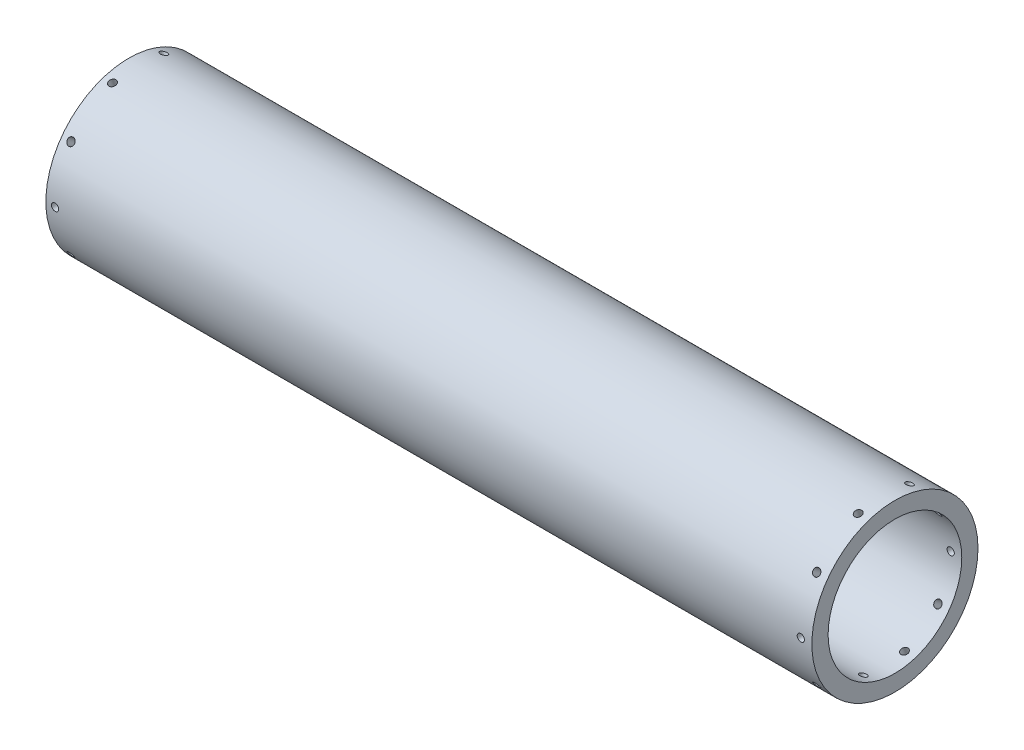
from build123d import *

# Parameters (mm, degrees)
SKETCH1_R           = 57.15
SKETCH1_R_2         = 45.974
BOSS_EXTRUDE1_DEPTH = 527.05
SKETCH2_R           = 57.15
SKETCH2_R_2         = 44.577
BOSS_EXTRUDE2_DEPTH = 88.9
SKETCH4_R           = 2.4892
CUT_EXTRUDE1_DEPTH  = 16.51
CIRPATTERN1_COUNT   = 10
SKETCH5_R           = 2.4892
CUT_EXTRUDE2_DEPTH  = 17.78
CIRPATTERN2_COUNT   = 10


with BuildPart() as part:
    # Sketch1 → Boss-Extrude1 (new body)
    with BuildSketch(Plane(origin=(0, 0, 0), x_dir=(0, 0, -1), z_dir=(1, 0, 0))):
        Circle(SKETCH1_R)
        Circle(SKETCH1_R_2, mode=Mode.SUBTRACT)
    extrude(amount=BOSS_EXTRUDE1_DEPTH)

    # Sketch2 → Boss-Extrude2 (add)
    with BuildSketch(Plane.ZY):
        Circle(SKETCH2_R)
        Circle(SKETCH2_R_2, mode=Mode.SUBTRACT)
    extrude(amount=-BOSS_EXTRUDE2_DEPTH)

    # Sketch4 → Cut-Extrude1 (cut)
    with BuildSketch(Plane.XY.offset(57.15)):
        with Locations((519.43, 0)):
            Circle(SKETCH4_R)
    cut_extrude1 = extrude(amount=-CUT_EXTRUDE1_DEPTH, mode=Mode.SUBTRACT)

    # CirPattern1: Cut-Extrude1 ×10 about axis
    cirpattern1_axis = Axis((0, 0, 0), (1, 0, 0))
    for i in range(1, CIRPATTERN1_COUNT):
        add(cut_extrude1.rotate(cirpattern1_axis, i * 360 / CIRPATTERN1_COUNT), mode=Mode.SUBTRACT)

    # Sketch5 → Cut-Extrude2 (cut)
    with BuildSketch(Plane.XY.offset(57.15)):
        with Locations((6.35, 0)):
            Circle(SKETCH5_R)
    cut_extrude2 = extrude(amount=-CUT_EXTRUDE2_DEPTH, mode=Mode.SUBTRACT)

    # CirPattern2: Cut-Extrude2 ×10 about axis
    cirpattern2_axis = Axis((0, 0, 0), (1, 0, 0))
    for i in range(1, CIRPATTERN2_COUNT):
        add(cut_extrude2.rotate(cirpattern2_axis, i * 360 / CIRPATTERN2_COUNT), mode=Mode.SUBTRACT)


solid = part.part
